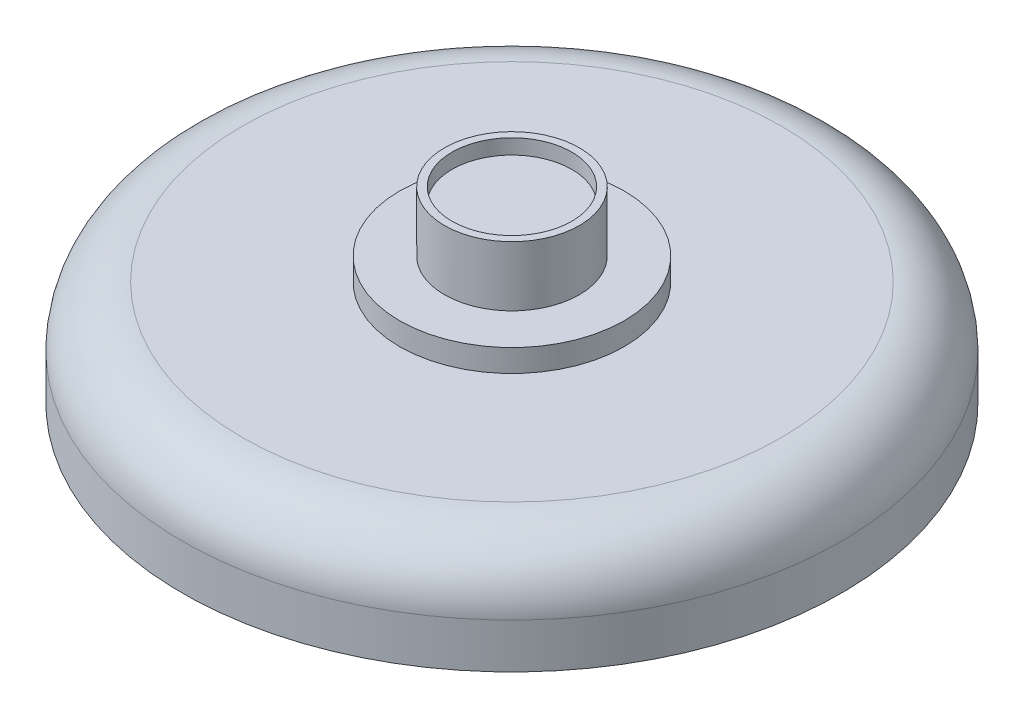
from build123d import *

# Parameters (mm, degrees)
BOSS_EXTRUDE1_DEPTH = 1.5
CUT_EXTRUDE1_DEPTH  = 2
SKETCH3_R           = 4
CUT_EXTRUDE2_DEPTH  = 2
SKETCH4_R           = 20
CUT_EXTRUDE3_DEPTH  = 0.5
FILLET1_R           = 1
SKETCH5_R           = 22
BOSS_EXTRUDE2_DEPTH = 3
SKETCH7_R           = 7.5
BOSS_EXTRUDE4_DEPTH = 1.5
SKETCH8_R           = 22
BOSS_EXTRUDE5_DEPTH = 7
SKETCH9_R           = 8
SKETCH9_R_2         = 6.5
CUT_EXTRUDE4_DEPTH  = 3
FILLET4_R           = 3
SKETCH10_R          = 46.144445172
SKETCH10_R_2        = 20.866025404
CUT_EXTRUDE5_DEPTH  = 6
CUT_EXTRUDE6_START  = -10
SKETCH12_R          = 20.866025404
SKETCH12_R_2        = 6.5
CUT_EXTRUDE6_DEPTH  = 10
FILLET5_R           = 4
SKETCH13_R          = 8.896552767
SKETCH13_R_2        = 4.5
CUT_EXTRUDE7_DEPTH  = 4
SKETCH14_R          = 4
BOSS_EXTRUDE7_DEPTH = 18


# Some blends are built 0.0001 mm under size
with BuildPart() as part:
    # Sketch1 → Boss-Extrude1 (new body)
    with BuildSketch(Plane(origin=(0, 0, 0), x_dir=(1, 0, 0), z_dir=(0, 1, 0))):
        with BuildLine():
            Line((-20.5, -35), (20.5, -35))
            ThreePointArc((20.5, -35), (24.035533906, -33.535533906), (25.5, -30))
            Line((25.5, -30), (25.5, 30))
            ThreePointArc((25.5, 30), (24.035533906, 33.535533906), (20.5, 35))
            Line((20.5, 35), (-20.5, 35))
            ThreePointArc((-20.5, 35), (-24.035533906, 33.535533906), (-25.5, 30))
            Line((-25.5, 30), (-25.5, -30))
            ThreePointArc((-25.5, -30), (-24.035533906, -33.535533906), (-20.5, -35))
        make_face()
    extrude(amount=BOSS_EXTRUDE1_DEPTH)

    # Sketch2 → Cut-Extrude1 (cut)
    with BuildSketch(Plane(origin=(0, 1.5, 0), x_dir=(1, 0, 0), z_dir=(0, 1, 0))):
        with BuildLine():
            Line((-21.5, 24.5), (-21.5, 28.5))
            ThreePointArc((-21.5, 28.5), (-17.5, 32.5), (-13.5, 28.5))
            Line((-13.5, 28.5), (-13.5, 24.5))
            ThreePointArc((-13.5, 24.5), (-17.5, 20.5), (-21.5, 24.5))
        make_face()
        with BuildLine():
            Line((13.5, 24.5), (13.5, 28.5))
            ThreePointArc((13.5, 28.5), (17.5, 32.5), (21.5, 28.5))
            Line((21.5, 28.5), (21.5, 24.5))
            ThreePointArc((21.5, 24.5), (17.5, 20.5), (13.5, 24.5))
        make_face()
    cut_extrude1 = extrude(amount=-CUT_EXTRUDE1_DEPTH, mode=Mode.SUBTRACT)

    # Mirror1: Cut-Extrude1 across plane
    add(cut_extrude1.mirror(Plane.XY), mode=Mode.SUBTRACT)

    # Sketch3 → Cut-Extrude2 (cut)
    with BuildSketch(Plane(origin=(0, 1.5, 0), x_dir=(1, 0, 0), z_dir=(0, 1, 0))):
        with Locations(Location((0, 0, 0), (0, 0, 270))):
            Circle(SKETCH3_R)
    extrude(amount=-CUT_EXTRUDE2_DEPTH, mode=Mode.SUBTRACT)

    # Sketch4 → Cut-Extrude3 (cut)
    with BuildSketch(Plane(origin=(0, 1.5, 0), x_dir=(1, 0, 0), z_dir=(0, 1, 0))):
        with Locations(Location((0, 0, 0), (0, 0, 270))):
            Circle(SKETCH4_R)
    extrude(amount=-CUT_EXTRUDE3_DEPTH, mode=Mode.SUBTRACT)

    # Fillet1
    # the kernel refuses this fillet: 1 mm, written as the material it takes off along each edge
    with BuildSketch(Plane(origin=(0, 1.5, 0), x_dir=(0, 0, 1), z_dir=(-1, 0, 0))) as fillet1_piece_1:
        with BuildLine():
            CenterArc((20.866025404, -1), FILLET1_R, 90, 60)
            Line((20, -0.5), (19.982679492, -0.49))
            ThreePointArc((19.982679492, -0.49), (19.98, -0.25), (19.98, 0))
            Line((19.98, 0), (20, 0.02))
            Line((20, 0.02), (20.866025404, 0.02))
            Line((20.866025404, 0.02), (20.866025404, 0))
        make_face()
    revolve(axis=Axis((0, 1.5, 0), (0, 1, 0)), mode=Mode.SUBTRACT)

    # Sketch5 → Boss-Extrude2 (add)
    with BuildSketch(Plane.XZ):
        with Locations(Location((0, 0, 0), (0, 0, 270))):
            Circle(SKETCH5_R)
    extrude(amount=BOSS_EXTRUDE2_DEPTH)

    # Sketch7 → Boss-Extrude4 (add)
    with BuildSketch(Plane.XZ.offset(3)):
        with Locations(Location((0, 0, 0), (0, 0, 270))):
            Circle(SKETCH7_R)
    extrude(amount=BOSS_EXTRUDE4_DEPTH)

    # Sketch8 → Boss-Extrude5 (add)
    with BuildSketch(Plane.XZ.offset(4.5)):
        with Locations(Location((0, 0, 0), (0, 0, 270))):
            Circle(SKETCH8_R)
    extrude(amount=BOSS_EXTRUDE5_DEPTH)

    # Sketch9 → Cut-Extrude4 (cut)
    with BuildSketch(Plane(origin=(0, 1, 0), x_dir=(1, 0, 0), z_dir=(0, 1, 0))):
        with Locations(Location((0, 0, 0), (0, 0, 270))):
            Circle(SKETCH9_R)
        with Locations(Location((0, 0, 0), (0, 0, 270))):
            Circle(SKETCH9_R_2, mode=Mode.SUBTRACT)
    extrude(amount=-CUT_EXTRUDE4_DEPTH, mode=Mode.SUBTRACT)

    # Fillet4
    fillet4_edges = [part.edges().sort_by_distance(p)[0] for p in [
        (0, 1, -8),
    ]]
    fillet(fillet4_edges, radius=FILLET4_R - 0.0001)  # a hair under: the kernel refuses the full size

    # Sketch10 → Cut-Extrude5 (cut)
    with BuildSketch(Plane(origin=(0, 1.5, 0), x_dir=(1, 0, 0), z_dir=(0, 1, 0))):
        Circle(SKETCH10_R)
        with Locations(Location((0, 0, 0), (0, 0, 270))):
            Circle(SKETCH10_R_2, mode=Mode.SUBTRACT)
    extrude(amount=-CUT_EXTRUDE5_DEPTH, mode=Mode.SUBTRACT)

    # Sketch12 → Cut-Extrude6 (cut)
    with BuildSketch(Plane.XZ.offset(3).offset(CUT_EXTRUDE6_START)):
        Circle(SKETCH12_R)
        with Locations(Location((0, 0, 0), (0, 0, 90))):
            Circle(SKETCH12_R_2, mode=Mode.SUBTRACT)
    extrude(amount=CUT_EXTRUDE6_DEPTH, mode=Mode.SUBTRACT)

    # Fillet5
    fillet5_edges = [part.edges().sort_by_distance(p)[0] for p in [
        (0, -4.5, 22),
    ]]
    fillet(fillet5_edges, radius=FILLET5_R)

    # Sketch13 → Cut-Extrude7 (cut)
    with BuildSketch(Plane(origin=(0, 1, 0), x_dir=(1, 0, 0), z_dir=(0, 1, 0))):
        Circle(SKETCH13_R)
        with Locations(Location((0, 0, 0), (0, 0, 270))):
            Circle(SKETCH13_R_2, mode=Mode.SUBTRACT)
    extrude(amount=-CUT_EXTRUDE7_DEPTH, mode=Mode.SUBTRACT)

    # Sketch14 → Boss-Extrude7 (add)
    with BuildSketch(Plane(origin=(0, 0, 0), x_dir=(1, 0, 0), z_dir=(0, 1, 0))):
        with Locations(Location((0, 0, 0), (0, 0, 270))):
            Circle(SKETCH14_R)
    extrude(amount=-BOSS_EXTRUDE7_DEPTH)


solid = part.part
